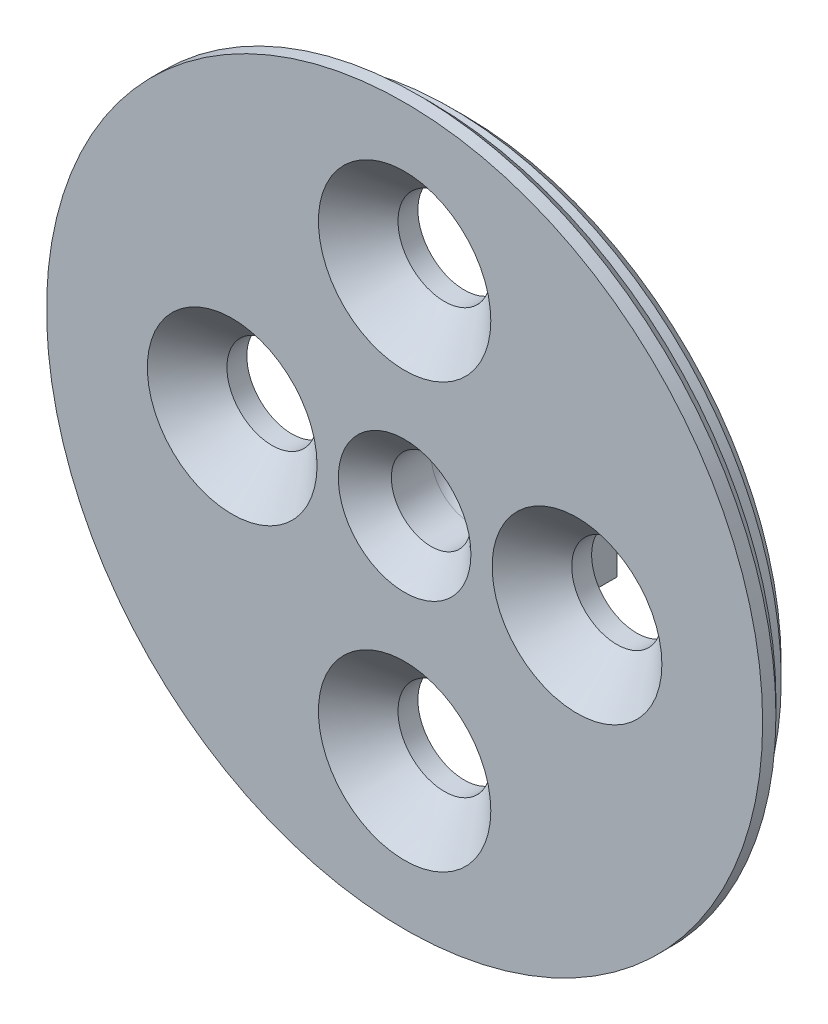
from build123d import *

# Parameters (mm, degrees)
SKETCH1_R           = 12.45
SKETCH1_R_2         = 1.7
BOSS_EXTRUDE1_DEPTH = 1.25
SKETCH2_W           = 5.5
SKETCH2_H           = 6.5
BOSS_EXTRUDE2_DEPTH = 3.5
BOSS_EXTRUDE3_START = 1
SKETCH3_R           = 13.5
SKETCH3_R_2         = 1.7
BOSS_EXTRUDE3_DEPTH = 1
CHAMFER1_SIZE       = 0.5
SKETCH5_R           = 1.75
CUT_EXTRUDE2_DEPTH  = 20.938969382
CHAMFER3_SIZE       = 1.5
CHAMFER2_SIZE       = 0.5
SKETCH6_R           = 1.5
CUT_EXTRUDE3_DEPTH  = 4
FILLET2_R           = 1.5
CHAMFER4_SIZE       = 1


with BuildPart() as part:
    # Sketch1 → Boss-Extrude1 (new body)
    with BuildSketch(Plane.XY):
        Circle(SKETCH1_R)
        with Locations((-6.5, 0)):
            Circle(SKETCH1_R_2, mode=Mode.SUBTRACT)
        with Locations((6.5, 0)):
            Circle(SKETCH1_R_2, mode=Mode.SUBTRACT)
    extrude(amount=-BOSS_EXTRUDE1_DEPTH)

    # Sketch2 → Boss-Extrude2 (add)
    with BuildSketch(Plane(origin=(0, 0, -1.25), x_dir=(-1, 0, 0), z_dir=(0, 0, -1))):
        Rectangle(SKETCH2_W, SKETCH2_H)
    extrude(amount=BOSS_EXTRUDE2_DEPTH)

    # Sketch3 → Boss-Extrude3 (add)
    with BuildSketch(Plane.XY.offset(BOSS_EXTRUDE3_START)):
        Circle(SKETCH3_R)
        with Locations((-6.5, 0)):
            Circle(SKETCH3_R_2, mode=Mode.SUBTRACT)
        with Locations((6.5, 0)):
            Circle(SKETCH3_R_2, mode=Mode.SUBTRACT)
    extrude(amount=-BOSS_EXTRUDE3_DEPTH)

    # Chamfer1
    chamfer1_edges = [part.edges().sort_by_distance(p)[0] for p in [
        (0, 3.25, -4.75),
        (2.75, 0, -4.75),
        (0, -3.25, -4.75),
        (-2.75, 0, -4.75),
        (-12.45, 0, -1.25),
    ]]
    chamfer(chamfer1_edges, length=CHAMFER1_SIZE)

    # Sketch5 → Cut-Extrude2 (cut, through all)
    with BuildSketch(Plane.XY.offset(1)):
        with Locations((0, 8)):
            Circle(SKETCH5_R)
        with Locations((0, -8)):
            Circle(SKETCH5_R)
    extrude(amount=-CUT_EXTRUDE2_DEPTH, mode=Mode.SUBTRACT)

    # Chamfer3
    chamfer3_edges = [part.edges().sort_by_distance(p)[0] for p in [
        (4.8, 0, 1),
        (-8.2, 0, 1),
        (-1.75, 8, 1),
        (-1.75, -8, 1),
    ]]
    chamfer(chamfer3_edges, length=CHAMFER3_SIZE)

    # Chamfer2
    chamfer2_edges = [part.edges().sort_by_distance(p)[0] for p in [
        (-13.5, 0, 0),
    ]]
    chamfer(chamfer2_edges, length=CHAMFER2_SIZE)

    # Sketch6 → Cut-Extrude3 (cut)
    with BuildSketch(Plane.XY.offset(1)):
        Circle(SKETCH6_R)
    extrude(amount=-CUT_EXTRUDE3_DEPTH, mode=Mode.SUBTRACT)

    # Fillet2
    fillet2_edges = [part.edges().sort_by_distance(p)[0] for p in [
        (-1.5, 0, -3),
    ]]
    fillet(fillet2_edges, radius=FILLET2_R)

    # Chamfer4
    chamfer4_edges = [part.edges().sort_by_distance(p)[0] for p in [
        (-1.5, 0, 1),
    ]]
    chamfer(chamfer4_edges, length=CHAMFER4_SIZE)


solid = part.part
